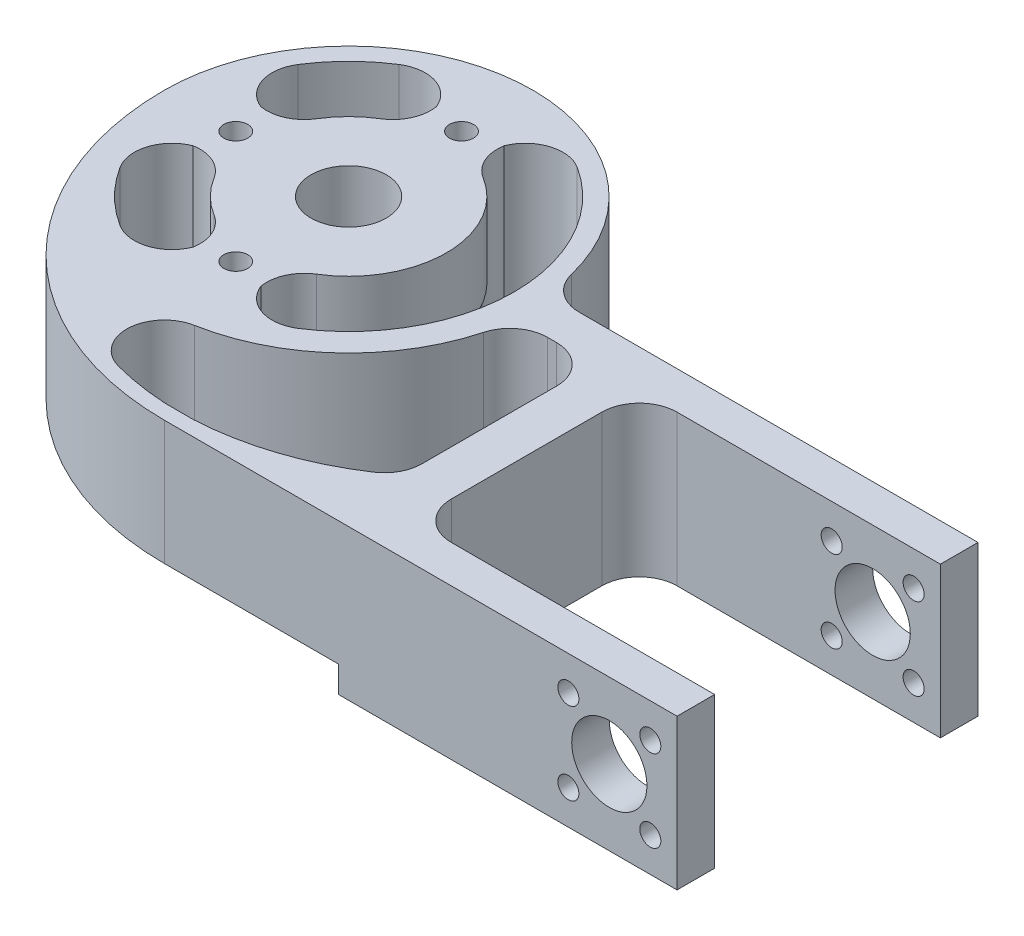
from build123d import *

# Parameters (mm, degrees)
SKETCH1_R           = 31.0896
BOSS_EXTRUDE1_DEPTH = 25.4
BOSS_EXTRUDE2_START = -20.955
BOSS_EXTRUDE2_DEPTH = 20.955
BOSS_EXTRUDE3_DEPTH = 25.4
CUT_EXTRUDE1_REACH  = 120.228
SKETCH4_R           = 6.35
SKETCH4_R_2         = 1.778
FILLET8_R           = 6.35
FILLET9_R           = 6.35
FILLET10_R          = 6.35
SKETCH12_R          = 2.0193
CUT_EXTRUDE7_DEPTH  = 25.4
CUT_EXTRUDE8_DEPTH  = 117.276883782
CUT_EXTRUDE9_DEPTH  = 118.15955649
FILLET14_R          = 6.35
SKETCH14_R          = 6.35
CUT_EXTRUDE10_DEPTH = 12.7
FILLET17_R          = 2.54
SKETCH14_3_R        = 6.35
CUT_EXTRUDE11_DEPTH = 118.15955649
FILLET18_R          = 3.556
FILLET19_R          = 6.35
FILLET20_R          = 6.35


with BuildPart() as part:
    # Sketch1 → Boss-Extrude1 (new body)
    with BuildSketch(Plane(origin=(0, 0, 0), x_dir=(1, 0, 0), z_dir=(0, 1, 0))):
        with Locations(Location((0, 0, 0), (0, 0, 270))):
            Circle(SKETCH1_R)
    extrude(amount=BOSS_EXTRUDE1_DEPTH)

    # Sketch2 → Boss-Extrude2 (add)
    with BuildSketch(Plane(origin=(0, 25.4, 0), x_dir=(1, 0, 0), z_dir=(0, 1, 0)).offset(BOSS_EXTRUDE2_START)):
        with BuildLine():
            Line((46.542690567, -48.26), (17.1704, -48.26))
            ThreePointArc((17.1704, -48.26), (-16.95457326, -34.12497326), (-31.0896, 0))
            ThreePointArc((-31.0896, 0), (1.271062728, -31.063606161), (30.985668109, 2.54))
            Line((30.985668109, 2.54), (46.542690567, 2.54))
            Line((46.542690567, 2.54), (46.542690567, -48.26))
        make_face()
    extrude(amount=BOSS_EXTRUDE2_DEPTH)

    # Sketch3 → Boss-Extrude3 (add)
    with BuildSketch(Plane(origin=(0, 25.4, 0), x_dir=(1, 0, 0), z_dir=(0, 1, 0))):
        Polygon((46.542690567, -0.333607673), (46.542690567, -48.26), (103.692690567, -48.26), (103.692690567, -41.91), (52.892690567, -41.91), (52.892690567, -3.81), (103.692690567, -3.81), (103.692690567, 2.54), (46.542690567, 2.54), align=None)
    extrude(amount=-BOSS_EXTRUDE3_DEPTH)

    # Cut-Extrude1: up to this face of the body (flat: up to its plane)
    cut_extrude1_end = Plane(part.part.faces().sort_by_distance((62.236361561, 13.361765969, 48.26))[0])
    # Sketch4 → Cut-Extrude1 (cut, up to the picked face)
    with BuildSketch(Plane(origin=(0, 0, -2.54), x_dir=(-1, 0, 0), z_dir=(0, 0, -1)), mode=Mode.PRIVATE) as cut_extrude1_sk1:
        with Locations((-92.262690567, 12.7)):
            Circle(SKETCH4_R)
    cut_extrude1_tool1 = split(extrude(cut_extrude1_sk1.sketch, amount=-CUT_EXTRUDE1_REACH, mode=Mode.PRIVATE), bisect_by=cut_extrude1_end, keep=Keep.BOTH, mode=Mode.PRIVATE)
    # Sketch4 → Cut-Extrude1 (cut, up to the picked face)
    with BuildSketch(Plane(origin=(0, 0, -2.54), x_dir=(-1, 0, 0), z_dir=(0, 0, -1)), mode=Mode.PRIVATE) as cut_extrude1_sk2:
        with Locations((-85.347893353, 5.785202787)):
            Circle(SKETCH4_R_2)
    cut_extrude1_tool2 = split(extrude(cut_extrude1_sk2.sketch, amount=-CUT_EXTRUDE1_REACH, mode=Mode.PRIVATE), bisect_by=cut_extrude1_end, keep=Keep.BOTH, mode=Mode.PRIVATE)
    # Sketch4 → Cut-Extrude1 (cut, up to the picked face)
    with BuildSketch(Plane(origin=(0, 0, -2.54), x_dir=(-1, 0, 0), z_dir=(0, 0, -1)), mode=Mode.PRIVATE) as cut_extrude1_sk3:
        with Locations((-99.17748778, 19.614797213)):
            Circle(SKETCH4_R_2)
    cut_extrude1_tool3 = split(extrude(cut_extrude1_sk3.sketch, amount=-CUT_EXTRUDE1_REACH, mode=Mode.PRIVATE), bisect_by=cut_extrude1_end, keep=Keep.BOTH, mode=Mode.PRIVATE)
    # Sketch4 → Cut-Extrude1 (cut, up to the picked face)
    with BuildSketch(Plane(origin=(0, 0, -2.54), x_dir=(-1, 0, 0), z_dir=(0, 0, -1)), mode=Mode.PRIVATE) as cut_extrude1_sk4:
        with Locations((-99.17748778, 5.785202787)):
            Circle(SKETCH4_R_2)
    cut_extrude1_tool4 = split(extrude(cut_extrude1_sk4.sketch, amount=-CUT_EXTRUDE1_REACH, mode=Mode.PRIVATE), bisect_by=cut_extrude1_end, keep=Keep.BOTH, mode=Mode.PRIVATE)
    # Sketch4 → Cut-Extrude1 (cut, up to the picked face)
    with BuildSketch(Plane(origin=(0, 0, -2.54), x_dir=(-1, 0, 0), z_dir=(0, 0, -1)), mode=Mode.PRIVATE) as cut_extrude1_sk5:
        with Locations((-85.347893353, 19.614797213)):
            Circle(SKETCH4_R_2)
    cut_extrude1_tool5 = split(extrude(cut_extrude1_sk5.sketch, amount=-CUT_EXTRUDE1_REACH, mode=Mode.PRIVATE), bisect_by=cut_extrude1_end, keep=Keep.BOTH, mode=Mode.PRIVATE)
    add(cut_extrude1_tool1.solids().sort_by(Axis((92.262691, 12.7, -2.54), (0, 0, 1)))[0], mode=Mode.SUBTRACT)
    add(cut_extrude1_tool2.solids().sort_by(Axis((85.347893, 5.785203, -2.54), (0, 0, 1)))[0], mode=Mode.SUBTRACT)
    add(cut_extrude1_tool3.solids().sort_by(Axis((99.177488, 19.614797, -2.54), (0, 0, 1)))[0], mode=Mode.SUBTRACT)
    add(cut_extrude1_tool4.solids().sort_by(Axis((99.177488, 5.785203, -2.54), (0, 0, 1)))[0], mode=Mode.SUBTRACT)
    add(cut_extrude1_tool5.solids().sort_by(Axis((85.347893, 19.614797, -2.54), (0, 0, 1)))[0], mode=Mode.SUBTRACT)

    # Fillet8
    fillet8_edges = [part.edges().sort_by_distance(p)[0] for p in [
        (30.985668109, 14.9225, -2.54),
    ]]
    fillet(fillet8_edges, radius=FILLET8_R)

    # Fillet9
    fillet9_edges = [part.edges().sort_by_distance(p)[0] for p in [
        (52.892690567, 12.7, 41.91),
    ]]
    fillet(fillet9_edges, radius=FILLET9_R)

    # Fillet10
    fillet10_edges = [part.edges().sort_by_distance(p)[0] for p in [
        (52.892690567, 12.7, 3.81),
    ]]
    fillet(fillet10_edges, radius=FILLET10_R)

    # Sketch12 → Cut-Extrude7 (cut)
    with BuildSketch(Plane.XZ):
        with Locations(Location((0, 19.05, 0), (0, 0, 270))):
            Circle(SKETCH12_R)
        with Locations(Location((-19.05, 0, 0), (0, 0, 270))):
            Circle(SKETCH12_R)
        with Locations(Location((0, -19.05, 0), (0, 0, 270))):
            Circle(SKETCH12_R)
    extrude(amount=-CUT_EXTRUDE7_DEPTH, mode=Mode.SUBTRACT)

    # Sketch11 → Cut-Extrude8 (cut, through all)
    with BuildSketch(Plane(origin=(0, 4.445, 0), x_dir=(-1, 0, 0), z_dir=(0, -1, 0))):
        with BuildLine():
            ThreePointArc((-42.42562716, -38.185670129), (-31.491235445, -43.484314118), (-19.548109433, -45.72))
            Line((-19.548109433, -45.72), (-14.792690567, -45.72))
            ThreePointArc((-14.792690567, -45.72), (6.265591504, -39.328440147), (21.908663776, -23.849500552))
            ThreePointArc((21.908663776, -23.849500552), (-11.254705201, -30.366426129), (-32.160101446, -3.81))
            Line((-32.160101446, -3.81), (-45.272690567, -3.81))
            Line((-45.272690567, -3.81), (-45.272690567, -32.889262364))
            ThreePointArc((-45.272690567, -32.889262364), (-44.515817928, -35.895826235), (-42.42562716, -38.185670129))
        make_face()
    extrude(amount=-CUT_EXTRUDE8_DEPTH, mode=Mode.SUBTRACT)

    # Sketch13 → Cut-Extrude9 (cut, through all)
    with BuildSketch(Plane.XZ):
        with BuildLine():
            ThreePointArc((-15.912153412, 4.402666667), (-11.674332957, 11.674332957), (-4.402666667, 15.912153412))
            Line((-4.402666667, 15.912153412), (-7.450666667, 26.928259621))
            ThreePointArc((-7.450666667, 26.928259621), (-19.756563466, 19.756563466), (-26.928259621, 7.450666667))
            Line((-26.928259621, 7.450666667), (-15.912153412, 4.402666667))
        make_face()
        with BuildLine():
            ThreePointArc((-4.402666667, -15.912153412), (-11.674332957, -11.674332957), (-15.912153412, -4.402666667))
            Line((-15.912153412, -4.402666667), (-26.928259621, -7.450666667))
            ThreePointArc((-26.928259621, -7.450666667), (-19.756563466, -19.756563466), (-7.450666667, -26.928259621))
            Line((-7.450666667, -26.928259621), (-4.402666667, -15.912153412))
        make_face()
        with BuildLine():
            ThreePointArc((16.052613052, -3.859237515), (11.871091462, -11.474200953), (4.402666667, -15.912153412))
            Line((4.402666667, -15.912153412), (7.450666667, -26.928259621))
            ThreePointArc((7.450666667, -26.928259621), (20.089539397, -19.417878535), (27.16596055, -6.531017333))
            Line((27.16596055, -6.531017333), (16.052613052, -3.859237515))
        make_face()
        with BuildLine():
            Line((7.450666667, 26.928259621), (4.402666667, 15.912153412))
            ThreePointArc((4.402666667, 15.912153412), (11.674332957, 11.674332957), (15.912153412, 4.402666667))
            Line((15.912153412, 4.402666667), (26.928259621, 7.450666667))
            ThreePointArc((26.928259621, 7.450666667), (19.756563466, 19.756563466), (7.450666667, 26.928259621))
        make_face()
        with BuildLine():
            Line((26.928259621, 7.450666667), (15.912153412, 4.402666667))
            ThreePointArc((15.912153412, 4.402666667), (16.359855636, 2.221536311), (16.51, 0))
            ThreePointArc((16.51, 0), (16.395254519, -1.943123582), (16.052613052, -3.859237515))
            Line((16.052613052, -3.859237515), (27.16596055, -6.531017333))
            ThreePointArc((27.16596055, -6.531017333), (27.74581534, -3.288362985), (27.94, 0))
            ThreePointArc((27.94, 0), (27.685909537, 3.759522987), (26.928259621, 7.450666667))
        make_face()
    extrude(amount=-CUT_EXTRUDE9_DEPTH, mode=Mode.SUBTRACT)

    # Fillet14
    # the kernel refuses this fillet: 6.35 mm, written as the material it adds along each edge
    with BuildSketch(Plane(origin=(4.402666667, 0, 15.912153412), x_dir=(0.9168524179546728, 0, -0.39922630636102885), z_dir=(0, 1, 0)), Plane(origin=(-15.912153412, 0, 4.402666667), x_dir=(0.39922630636102924, 0, 0.9168524179546726), z_dir=(0, 1, 0)), Plane(origin=(-4.402666667, 0, -15.912153412), x_dir=(-0.9168524179546725, 0, 0.39922630636102946), z_dir=(0, 1, 0))) as fillet14_piece_1:
        with BuildLine():
            CenterArc((5.522661099, -6.287214109), FILLET14_R, 98.063810107, 73.872379787)
            Line((-0.76455301, -5.396462319), (0, 0))
            ThreePointArc((0, 0), (2.315954654, -0.163243317), (4.631909309, 0))
        make_face()
    extrude(amount=25.4)
    with BuildSketch(Plane(origin=(7.450666667, 0, 26.928259621), x_dir=(-0.26666666666666666, 0, -0.9637888196533975), z_dir=(0, 1, 0)), Plane(origin=(-26.928259621, 0, 7.450666667), x_dir=(0.9637888196533974, 0, -0.2666666666666667), z_dir=(0, 1, 0)), Plane(origin=(-7.450666667, 0, -26.928259621), x_dir=(0.2666666666666671, 0, 0.9637888196533972), z_dir=(0, 1, 0))) as fillet14_piece_2:
        with BuildLine():
            CenterArc((7.304942452, -6.35), FILLET14_R, 90, 107.104635177)
            ThreePointArc((1.235807879, -8.217647059), (0.310679271, -4.1550254), (0, 0))
            Line((0, 0), (7.304942452, 0))
        make_face()
    extrude(amount=25.4)
    with BuildSketch(Plane(origin=(-4.402666667, 0, 15.912153412), x_dir=(-0.9168524179546724, 0, -0.3992263063610298), z_dir=(0, 1, 0)), Plane(origin=(-15.912153412, 0, -4.402666667), x_dir=(0.39922630636103035, 0, -0.9168524179546722), z_dir=(0, 1, 0))) as fillet14_piece_3:
        with BuildLine():
            CenterArc((5.522661099, 6.287214109), FILLET14_R, 188.063810107, 73.872379787)
            Line((-0.76455301, 5.396462319), (0, 0))
            ThreePointArc((0, 0), (2.315954654, 0.163243317), (4.631909309, 0))
        make_face()
    extrude(amount=25.4)
    with BuildSketch(Plane(origin=(-7.450666667, 0, 26.928259621), x_dir=(-0.913415305638585, 0, -0.407028843480619), z_dir=(0, 1, 0)), Plane(origin=(-26.928259621, 0, -7.450666667), x_dir=(0.40702884348061935, 0, -0.9134153056385848), z_dir=(0, 1, 0))) as fillet14_piece_4:
        with BuildLine():
            CenterArc((7.365726845, -6.279391075), FILLET14_R, 81.447682412, 107.104635177)
            Line((1.086335771, -7.223715029), (0, 0))
            ThreePointArc((0, 0), (4.1550254, 0.310679271), (8.3100508, 0))
        make_face()
    extrude(amount=25.4)
    with BuildSketch(Plane(origin=(7.450666667, 0, -26.928259621), x_dir=(-0.2666666666666663, 0, 0.9637888196533975), z_dir=(0, 1, 0))) as fillet14_piece_5:
        with BuildLine():
            CenterArc((7.304942452, 6.35), FILLET14_R, 162.895364823, 107.104635177)
            ThreePointArc((1.235807879, 8.217647059), (0.310679271, 4.1550254), (0, 0))
            Line((0, 0), (7.304942452, 0))
        make_face()
    extrude(amount=25.4)
    with BuildSketch(Plane(origin=(4.402666667, 0, -15.912153412), x_dir=(0.2666666666666646, 0, -0.9637888196533979), z_dir=(0, 1, 0))) as fillet14_piece_6:
        with BuildLine():
            CenterArc((5.450352912, -6.35), FILLET14_R, 90, 73.872379787)
            ThreePointArc((-0.649745119, -4.586111111), (-0.163243317, -2.315954654), (0, 0))
            Line((0, 0), (5.450352912, 0))
        make_face()
    extrude(amount=25.4)

    # Sketch14 → Cut-Extrude10 (cut)
    with BuildSketch(Plane.XZ):
        with BuildLine():
            Line((-10.414, -10.414), (10.414, -10.414))
            ThreePointArc((10.414, -10.414), (20.828, 0), (10.414, 10.414))
            Line((10.414, 10.414), (-10.414, 10.414))
            Line((-10.414, 10.414), (-10.414, -10.414))
        make_face()
        with Locations(Location((0, 0, 0), (0, 0, 270))):
            Circle(SKETCH14_R, mode=Mode.SUBTRACT)
    extrude(amount=-CUT_EXTRUDE10_DEPTH, mode=Mode.SUBTRACT)

    # Fillet17
    # the kernel refuses this fillet: 2.54 mm, written as the material it takes off along each edge
    with BuildSketch(Plane(origin=(13.087195122, 12.7, 10.065059555), x_dir=(-0.7525451578932848, 0, 0.6585406481997684), z_dir=(0, -1, 0))) as fillet17_piece_1:
        with BuildLine():
            CenterArc((7.288242174, 2.538935053), FILLET17_R, 131.188669075, 137.152126286)
            Line((5.615548928, 4.450399754), (5.448279603, 4.641546224))
            ThreePointArc((5.448279603, 4.641546224), (2.074222188, 1.688960676), (-0.1125988, 0.227678524))
            Line((-0.1125988, 0.227678524), (-0.049545453, -0.249120951))
            ThreePointArc((-0.049545453, -0.249120951), (6.014734512, -0.336617786), (7.207343199, -0.253893505))
            Line((7.207343199, -0.253893505), (7.214697651, 0))
        make_face()
    extrude(amount=30.736744128, mode=Mode.SUBTRACT)
    with BuildSketch(Plane(origin=(13.087195122, 12.7, -10.065059555), x_dir=(-0.7525451578933744, 0, -0.658540648199666), z_dir=(0, -1, 0))) as fillet17_piece_2:
        with BuildLine():
            CenterArc((7.288242174, -2.538935053), FILLET17_R, 91.659204639, 137.152126286)
            Line((5.615548928, -4.450399754), (5.448279603, -4.641546224))
            ThreePointArc((5.448279603, -4.641546224), (2.074222188, -1.688960676), (-0.1125988, -0.227678524))
            Line((-0.1125988, -0.227678524), (-0.049545453, 0.249120951))
            ThreePointArc((-0.049545453, 0.249120951), (6.014734512, 0.336617786), (7.207343199, 0.253893505))
            Line((7.207343199, 0.253893505), (7.214697651, 0))
        make_face()
    extrude(amount=30.736744128, mode=Mode.SUBTRACT)

    # Sketch14<3> → Cut-Extrude11 (cut, through all)
    with BuildSketch(Plane.XZ):
        with Locations(Location((0, 0, 0), (0, 0, 270))):
            Circle(SKETCH14_3_R)
    extrude(amount=-CUT_EXTRUDE11_DEPTH, mode=Mode.SUBTRACT)

    # Fillet18
    fillet18_edges = [part.edges().sort_by_distance(p)[0] for p in [
        (-10.414, 6.35, -10.414),
        (-10.414, 6.35, 10.414),
    ]]
    fillet(fillet18_edges, radius=FILLET18_R)

    # Fillet19
    fillet19_edges = [part.edges().sort_by_distance(p)[0] for p in [
        (45.272690567, 14.9225, 3.81),
        (32.160101446, 14.9225, 3.81),
    ]]
    fillet(fillet19_edges, radius=FILLET19_R)

    # Fillet20
    fillet20_edges = [part.edges().sort_by_distance(p)[0] for p in [
        (-21.908663776, 14.9225, 23.849500552),
    ]]
    fillet(fillet20_edges, radius=FILLET20_R)


solid = part.part
